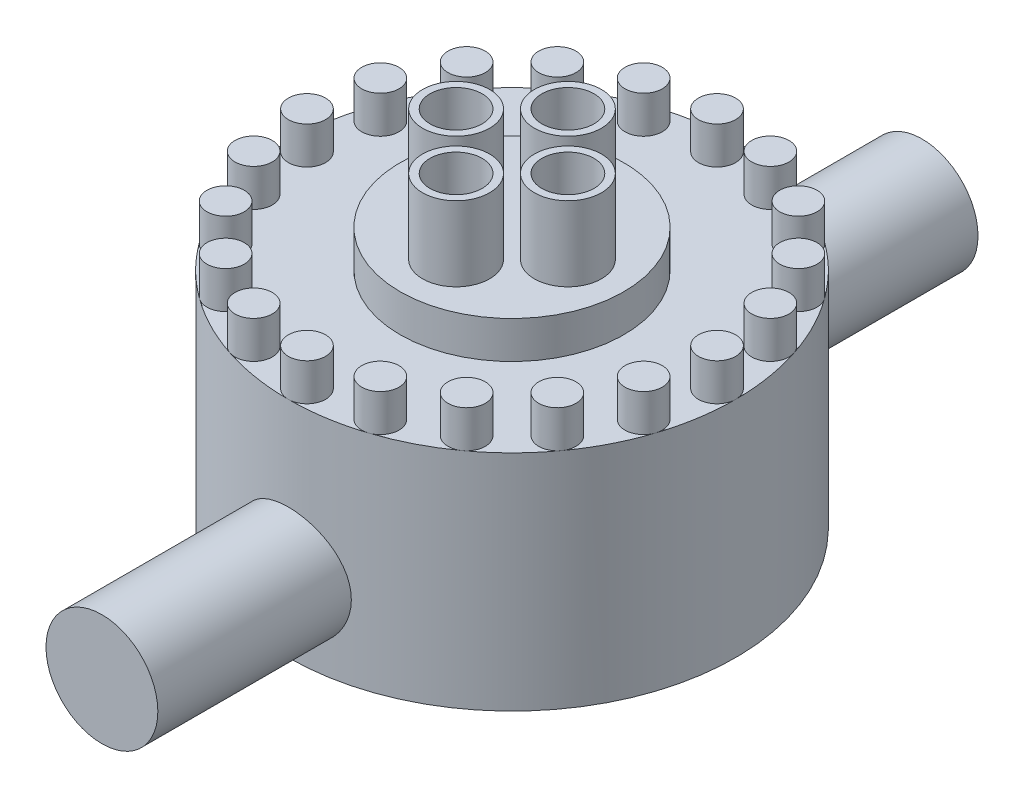
from build123d import *

# Parameters (mm, degrees)
SKETCH1_R           = 300
BOSS_EXTRUDE1_DEPTH = 300
SKETCH2_R           = 25
BOSS_EXTRUDE2_DEPTH = 50
SKETCH3_R           = 150
BOSS_EXTRUDE3_DEPTH = 50
SKETCH4_R           = 35
CUT_EXTRUDE2_DEPTH  = 551
BOSS_EXTRUDE5_START = 100
SKETCH5_R           = 45
SKETCH5_R_2         = 35
BOSS_EXTRUDE5_DEPTH = 100
SKETCH7_R           = 75
BOSS_EXTRUDE6_DEPTH = 400
SKETCH8_R           = 75
BOSS_EXTRUDE7_DEPTH = 400


with BuildPart() as part:
    # Sketch1 → Boss-Extrude1 (new body)
    with BuildSketch(Plane(origin=(0, 0, 0), x_dir=(1, 0, 0), z_dir=(0, 1, 0))):
        Circle(SKETCH1_R)
    extrude(amount=BOSS_EXTRUDE1_DEPTH)

    # Sketch2 → Boss-Extrude2 (add)
    with BuildSketch(Plane(origin=(0, 300, 0), x_dir=(1, 0, 0), z_dir=(0, 1, 0))):
        with Locations((0, 275)):
            Circle(SKETCH2_R)
        with Locations((84.979673453, 261.540541981)):
            Circle(SKETCH2_R)
        with Locations((161.64094438, 222.479673453)):
            Circle(SKETCH2_R)
        with Locations((222.479673453, 161.64094438)):
            Circle(SKETCH2_R)
        with Locations((261.540541981, 84.979673453)):
            Circle(SKETCH2_R)
        with Locations((275, 0)):
            Circle(SKETCH2_R)
        with Locations((261.540541981, -84.979673453)):
            Circle(SKETCH2_R)
        with Locations((222.479673453, -161.64094438)):
            Circle(SKETCH2_R)
        with Locations((161.640944381, -222.479673453)):
            Circle(SKETCH2_R)
        with Locations((84.979673453, -261.540541981)):
            Circle(SKETCH2_R)
        with Locations((0, -275)):
            Circle(SKETCH2_R)
        with Locations((-84.979673453, -261.540541981)):
            Circle(SKETCH2_R)
        with Locations((-161.64094438, -222.479673453)):
            Circle(SKETCH2_R)
        with Locations((-222.479673453, -161.64094438)):
            Circle(SKETCH2_R)
        with Locations((-261.540541981, -84.979673453)):
            Circle(SKETCH2_R)
        with Locations((-275, 0)):
            Circle(SKETCH2_R)
        with Locations((-261.540541981, 84.979673453)):
            Circle(SKETCH2_R)
        with Locations((-222.479673453, 161.64094438)):
            Circle(SKETCH2_R)
        with Locations((-161.64094438, 222.479673453)):
            Circle(SKETCH2_R)
        with Locations((-84.979673453, 261.540541981)):
            Circle(SKETCH2_R)
    extrude(amount=BOSS_EXTRUDE2_DEPTH)

    # Sketch3 → Boss-Extrude3 (add)
    with BuildSketch(Plane(origin=(0, 300, 0), x_dir=(1, 0, 0), z_dir=(0, 1, 0))):
        Circle(SKETCH3_R)
    extrude(amount=BOSS_EXTRUDE3_DEPTH)

    # Sketch4 → Cut-Extrude2 (cut, through all)
    with BuildSketch(Plane(origin=(0, 350, 0), x_dir=(1, 0, 0), z_dir=(0, 1, 0))):
        with Locations((0, 75)):
            Circle(SKETCH4_R)
        with Locations((75, 0)):
            Circle(SKETCH4_R)
        with Locations((0, -75)):
            Circle(SKETCH4_R)
        with Locations((-75, 0)):
            Circle(SKETCH4_R)
    extrude(amount=-CUT_EXTRUDE2_DEPTH, mode=Mode.SUBTRACT)

    # Sketch5 → Boss-Extrude5 (add)
    # profile 1 of 4: a face of its own
    with BuildSketch(Plane(origin=(0, 350, 0), x_dir=(1, 0, 0), z_dir=(0, 1, 0)).offset(BOSS_EXTRUDE5_START)):
        with Locations((0, 75)):
            Circle(SKETCH5_R)
        with Locations((0, 75)):
            Circle(SKETCH5_R_2, mode=Mode.SUBTRACT)
    # profile 2 of 4: a face of its own
    with BuildSketch(Plane(origin=(0, 350, 0), x_dir=(1, 0, 0), z_dir=(0, 1, 0)).offset(BOSS_EXTRUDE5_START)):
        with Locations((75, 0)):
            Circle(SKETCH5_R)
        with Locations((75, 0)):
            Circle(SKETCH5_R_2, mode=Mode.SUBTRACT)
    # profile 3 of 4: a face of its own
    with BuildSketch(Plane(origin=(0, 350, 0), x_dir=(1, 0, 0), z_dir=(0, 1, 0)).offset(BOSS_EXTRUDE5_START)):
        with Locations((0, -75)):
            Circle(SKETCH5_R)
        with Locations((0, -75)):
            Circle(SKETCH5_R_2, mode=Mode.SUBTRACT)
    # profile 4 of 4: a face of its own
    with BuildSketch(Plane(origin=(0, 350, 0), x_dir=(1, 0, 0), z_dir=(0, 1, 0)).offset(BOSS_EXTRUDE5_START)):
        with Locations((-75, 0)):
            Circle(SKETCH5_R)
        with Locations((-75, 0)):
            Circle(SKETCH5_R_2, mode=Mode.SUBTRACT)
    extrude(amount=-BOSS_EXTRUDE5_DEPTH)

    # Sketch7 → Boss-Extrude6 (add)
    with BuildSketch(Plane.XY.offset(150)):
        with Locations((0, 100)):
            Circle(SKETCH7_R)
    extrude(amount=BOSS_EXTRUDE6_DEPTH)

    # Sketch8 → Boss-Extrude7 (add)
    with BuildSketch(Plane.XY.offset(-150)):
        with Locations((0, 102.505159037)):
            Circle(SKETCH8_R)
    extrude(amount=-BOSS_EXTRUDE7_DEPTH)


solid = part.part
